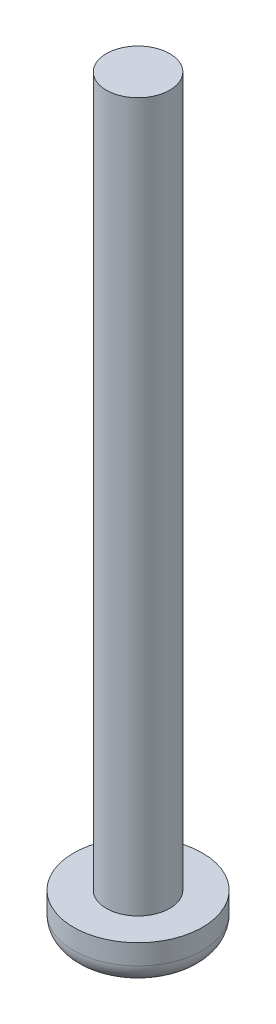
from build123d import *

# Parameters (mm, degrees)
SKETCH1_R           = 1.25
BOSS_EXTRUDE1_DEPTH = 27.94
SKETCH2_R           = 2.54
BOSS_EXTRUDE2_DEPTH = 1.5875
CUT_EXTRUDE1_DEPTH  = 0.79375
FILLET1_R           = 0.79375
FILLET2_R           = 0.049609375


with BuildPart() as part:
    # Sketch1 → Boss-Extrude1 (new body)
    with BuildSketch(Plane(origin=(0, 0, 0), x_dir=(1, 0, 0), z_dir=(0, 1, 0))):
        with Locations(Location((0, 0, 0), (0, 0, 270))):
            Circle(SKETCH1_R)
    extrude(amount=BOSS_EXTRUDE1_DEPTH)

    # Sketch2 → Boss-Extrude2 (add)
    with BuildSketch(Plane.XZ):
        with Locations(Location((0, 0, 0), (0, 0, 270))):
            Circle(SKETCH2_R)
    extrude(amount=BOSS_EXTRUDE2_DEPTH)

    # Sketch3 → Cut-Extrude1 (cut)
    with BuildSketch(Plane.XZ.offset(1.5875)):
        Polygon((-1.7859375, 0.1984375), (-1.7859375, -0.1984375), (-0.1984375, -0.1984375), (-0.1984375, -1.7859375), (0.1984375, -1.7859375), (0.1984375, -0.1984375), (1.7859375, -0.1984375), (1.7859375, 0.1984375), (0.1984375, 0.1984375), (0.1984375, 1.7859375), (-0.1984375, 1.7859375), (-0.1984375, 0.1984375), align=None)
    extrude(amount=-CUT_EXTRUDE1_DEPTH, mode=Mode.SUBTRACT)

    # Fillet1
    # the kernel refuses this fillet: 0.79375 mm, written as the material it takes off along each edge
    with BuildSketch(Plane(origin=(0, -1.5875, 0), x_dir=(0, 0, -1), z_dir=(-1, 0, 0))) as fillet1_piece_1:
        with BuildLine():
            CenterArc((2.54 - FILLET1_R, -FILLET1_R), FILLET1_R, 0, 90)
            Line((2.54 - FILLET1_R, 0), (2.54, 0))
            Line((2.54, 0), (2.54, -FILLET1_R))
        make_face()
    revolve(axis=Axis((0, -1.5875, 0), (0, -1, 0)), mode=Mode.SUBTRACT)

    # Fillet2
    fillet2_edges = [part.edges().sort_by_distance(p)[0] for p in [
        (-0.9921875, -0.79375, 0.1984375),
        (-1.7859375, -1.189815274, 0.1984375),
        (-0.1984375, -0.79375, 0.9921875),
        (-0.1984375, -1.190625, 0.1984375),
        (0, -0.79375, 1.7859375),
        (-0.1984375, -1.189815274, 1.7859375),
        (0.1984375, -0.79375, 0.9921875),
        (0.1984375, -1.189815274, 1.7859375),
        (0.9921875, -0.79375, 0.1984375),
        (0.1984375, -1.190625, 0.1984375),
        (1.7859375, -0.79375, 0),
        (1.7859375, -1.189815274, 0.1984375),
        (0.9921875, -0.79375, -0.1984375),
        (1.7859375, -1.189815274, -0.1984375),
        (0.1984375, -0.79375, -0.9921875),
        (0.1984375, -1.190625, -0.1984375),
        (0, -0.79375, -1.7859375),
        (0.1984375, -1.189815274, -1.7859375),
        (-0.1984375, -0.79375, -0.9921875),
        (-0.1984375, -1.189815274, -1.7859375),
        (-0.9921875, -0.79375, -0.1984375),
        (-0.1984375, -1.190625, -0.1984375),
        (-1.7859375, -0.79375, 0),
        (-1.7859375, -1.189815274, -0.1984375),
        (-0.966688003, -1.5875, 0.1984375),
        (-0.1984375, -1.5875, -0.966688003),
        (0.966688003, -1.5875, -0.1984375),
        (0.1984375, -1.5875, 0.966688003),
        (-0.1984375, -1.5875, 0.966688003),
        (0.966688003, -1.5875, 0.1984375),
        (0.1984375, -1.5875, -0.966688003),
        (-0.966688003, -1.5875, -0.1984375),
        (0.1984375, -1.587095111, 1.760450859),
        (0, -1.586507192, 1.7859375),
        (-0.1984375, -1.587095111, 1.760450859),
        (-1.760450859, -1.587095111, 0.1984375),
        (-1.7859375, -1.586507192, 0),
        (-1.760450859, -1.587095111, -0.1984375),
        (-0.1984375, -1.587095111, -1.760450859),
        (0.099219305, -1.586364526, -1.7859375),
        (0.1984375, -1.587095111, -1.760450859),
        (1.760450859, -1.587095111, -0.1984375),
        (1.7859375, -1.586507192, 0),
        (1.760450859, -1.587095111, 0.1984375),
    ]]
    fillet(fillet2_edges, radius=FILLET2_R)


solid = part.part
